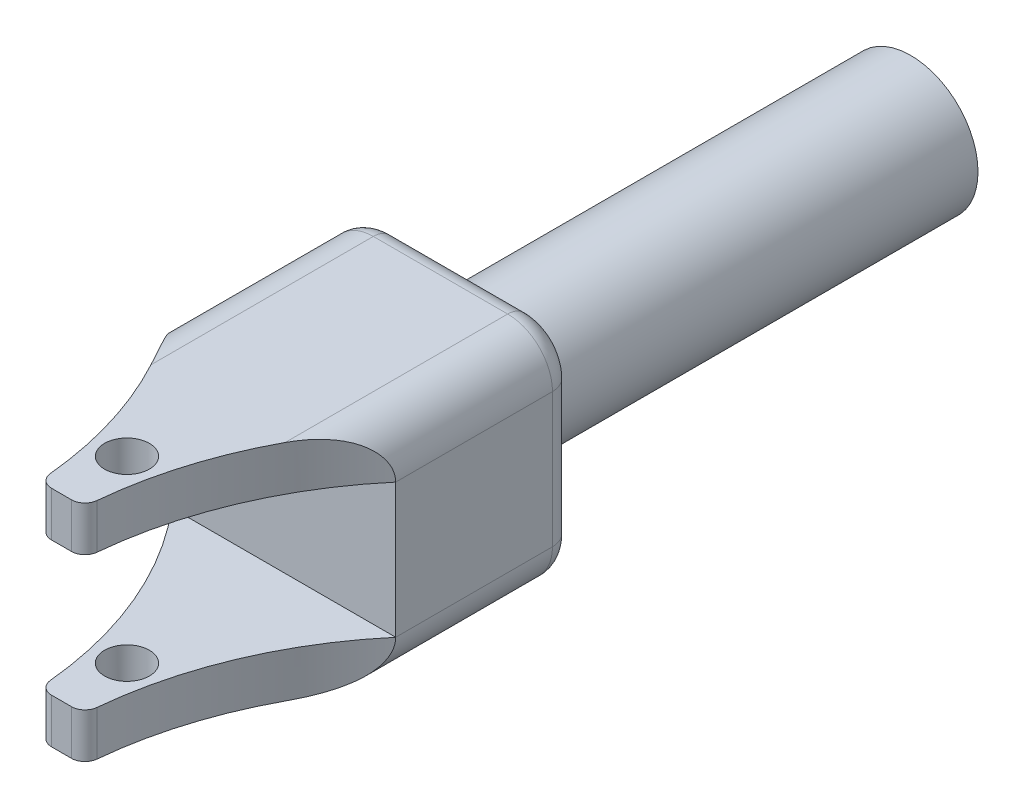
from build123d import *

# Parameters (mm, degrees)
SKETCH2_R               = 15
BOSS_EXTRUDE2_DEPTH     = 140
SKETCH4_W               = 50
SKETCH4_H               = 50
BOSS_EXTRUDE3_DEPTH     = 89.61
FILLET1_R               = 5
FILLET3_R               = 10
SKETCH6_W               = 49.61
SKETCH6_H               = 30
CUT_EXTRUDE1_DEPTH      = 44.805
CUT_EXTRUDE5_DEPTH      = 193.878075737
CUT_EXTRUDE5_DEPTH_BACK = 193.878075737
SKETCH7_R               = 5


with BuildPart() as part:
    # Sketch2 → Boss-Extrude2 (new body)
    with BuildSketch(Plane.XY):
        Circle(SKETCH2_R)
    extrude(amount=BOSS_EXTRUDE2_DEPTH)

    # Sketch4 → Boss-Extrude3 (add)
    with BuildSketch(Plane.XY.offset(100)):
        Rectangle(SKETCH4_W, SKETCH4_H)
    extrude(amount=BOSS_EXTRUDE3_DEPTH)

    # Fillet1
    fillet1_edges = [part.edges().sort_by_distance(p)[0] for p in [
        (25, 0, 100),
        (0, 25, 100),
        (-25, 0, 100),
        (0, -25, 100),
    ]]
    fillet(fillet1_edges, radius=FILLET1_R)

    # Fillet3
    # the kernel refuses this fillet: 10 mm, written as the material it takes off along each edge
    with BuildSketch(Plane(origin=(15, 15, 100), x_dir=(0, 1, 0), z_dir=(-1, 0, 0))) as fillet3_piece_1:
        with BuildLine():
            CenterArc((5, -5), 5, 0, 90)
            Line((10, -5), (10, 0))
            Line((10, 0), (5, 0))
        make_face()
    revolve(axis=Axis((15, 15, 100), (0, 0, -1)), revolution_arc=90, mode=Mode.SUBTRACT)
    with BuildSketch(Plane(origin=(15, -15, 100), x_dir=(1, 0, 0), z_dir=(0, 1, 0))) as fillet3_piece_2:
        with BuildLine():
            CenterArc((5, -5), 5, 0, 90)
            Line((10, -5), (10, 0))
            Line((10, 0), (5, 0))
        make_face()
    revolve(axis=Axis((15, -15, 100), (0, 0, -1)), revolution_arc=90, mode=Mode.SUBTRACT)
    with BuildSketch(Plane(origin=(-15, 15, 100), x_dir=(-1, 0, 0), z_dir=(0, -1, 0))) as fillet3_piece_3:
        with BuildLine():
            CenterArc((5, -5), 5, 0, 90)
            Line((10, -5), (10, 0))
            Line((10, 0), (5, 0))
        make_face()
    revolve(axis=Axis((-15, 15, 100), (0, 0, -1)), revolution_arc=90, mode=Mode.SUBTRACT)
    with BuildSketch(Plane(origin=(-15, -15, 100), x_dir=(0, -1, 0), z_dir=(1, 0, 0))) as fillet3_piece_4:
        with BuildLine():
            CenterArc((5, -5), 5, 0, 90)
            Line((10, -5), (10, 0))
            Line((10, 0), (5, 0))
        make_face()
    revolve(axis=Axis((-15, -15, 100), (0, 0, -1)), revolution_arc=90, mode=Mode.SUBTRACT)
    with BuildSketch(Plane(origin=(25, -25, 100), x_dir=(0, 1, 0), z_dir=(0, 0, 1)), Plane(origin=(-25, -25, 100), x_dir=(1, 0, 0), z_dir=(0, 0, 1))) as fillet3_piece_5:
        with BuildLine():
            CenterArc((FILLET3_R, FILLET3_R), FILLET3_R, 180, 90)
            Line((0, FILLET3_R), (0, 0))
            Line((0, 0), (FILLET3_R, 0))
        make_face()
    extrude(amount=114.61, mode=Mode.SUBTRACT)
    with BuildSketch(Plane(origin=(25, 25, 100), x_dir=(0, -1, 0), z_dir=(0, 0, 1)), Plane(origin=(-25, 25, 100), x_dir=(1, 0, 0), z_dir=(0, 0, 1))) as fillet3_piece_6:
        with BuildLine():
            CenterArc((FILLET3_R, -FILLET3_R), FILLET3_R, 90, 90)
            Line((0, -FILLET3_R), (0, 0))
            Line((0, 0), (FILLET3_R, 0))
        make_face()
    extrude(amount=114.61, mode=Mode.SUBTRACT)

    # Sketch6 → Cut-Extrude1 (cut, symmetric)
    with BuildSketch(Plane(origin=(0, 0, 0), x_dir=(0, 0, -1), z_dir=(1, 0, 0))):
        with Locations((-164.805, 0)):
            Rectangle(SKETCH6_W, SKETCH6_H)
    extrude(amount=CUT_EXTRUDE1_DEPTH, both=True, mode=Mode.SUBTRACT)

    # Sketch7 → Cut-Extrude5 (cut, two sides: drawn at the far end of the back side and taken through both)
    with BuildSketch(Plane(origin=(0, 0, 0), x_dir=(1, 0, 0), z_dir=(0, 1, 0)).offset(-CUT_EXTRUDE5_DEPTH_BACK)):
        with Locations(Location((0, -175, 0), (0, 0, 270))):
            Circle(SKETCH7_R)
        with BuildLine():
            Line((-2.228917094, -189.61), (2.228917094, -189.61))
            ThreePointArc((2.228917094, -189.61), (4.246928068, -188.829826954), (5.21534053, -186.895087804))
            ThreePointArc((5.21534053, -186.895087804), (11.515192631, -161.931906551), (25, -140))
            ThreePointArc((25, -140), (0, -208.138826335), (-25, -140))
            ThreePointArc((-25, -140), (-11.515192631, -161.931906551), (-5.21534053, -186.895087804))
            ThreePointArc((-5.21534053, -186.895087804), (-4.246928068, -188.829826954), (-2.228917094, -189.61))
        make_face()
    extrude(amount=CUT_EXTRUDE5_DEPTH + CUT_EXTRUDE5_DEPTH_BACK, mode=Mode.SUBTRACT)


solid = part.part
